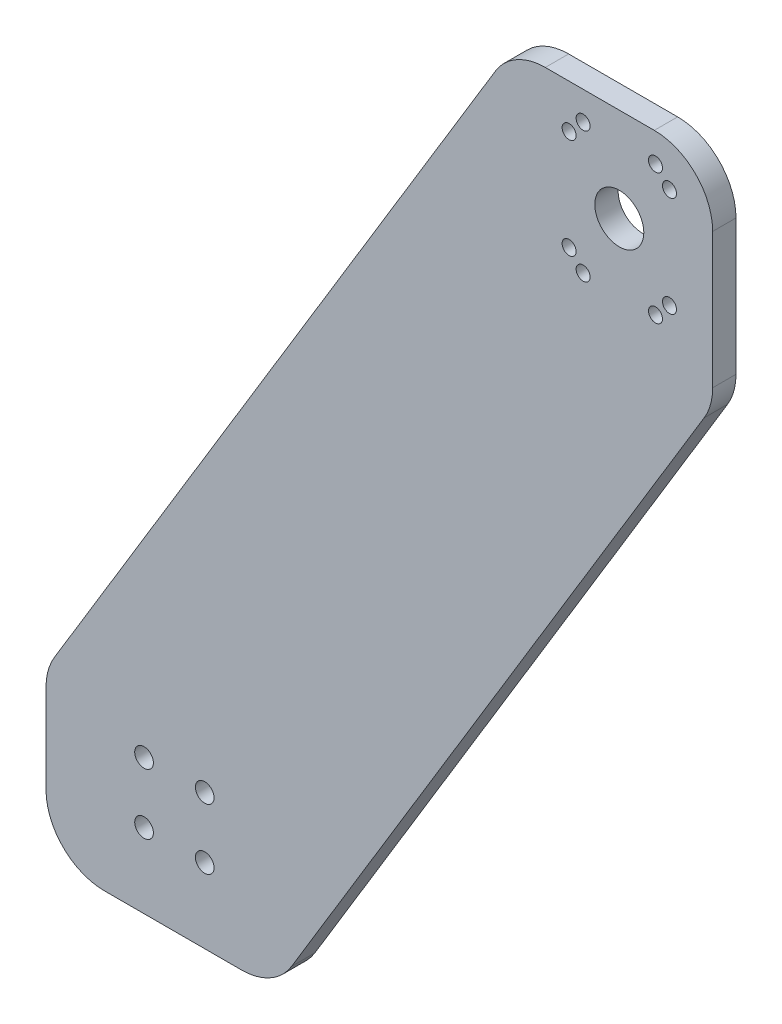
from build123d import *

# Parameters (mm, degrees)
SCHIZZO1_R                   = 4
SCHIZZO1_R_2                 = 10.5
SCHIZZO1_R_3                 = 3
ESTRUSIONE_ESTRUSIONE2_DEPTH = 10
SCHIZZO2_R                   = 2
TAGLIO_ESTRUSIONE1_DEPTH     = 15


with BuildPart() as part:
    # Schizzo1 → Estrusione-Estrusione2 (new body)
    with BuildSketch(Plane.XY):
        with BuildLine():
            Line((25, 0), (83.810825302, 0))
            ThreePointArc((83.810825302, 0), (96.083419143, 3.219654722), (105.194931806, 12.049324766))
            Line((105.194931806, 12.049324766), (282.024381214, 304.029450185))
            ThreePointArc((282.024381214, 304.029450185), (284.71933888, 310.257129904), (285.64027471, 316.980125419))
            Line((285.64027471, 316.980125419), (285.64027471, 375))
            ThreePointArc((285.64027471, 375), (278.31794424, 392.67766953), (260.64027471, 400))
            Line((260.64027471, 400), (213.941879948, 400))
            ThreePointArc((213.941879948, 400), (201.669286107, 396.780345278), (192.557773444, 387.950675234))
            Line((192.557773444, 387.950675234), (3.615893496, 75.970549815))
            ThreePointArc((3.615893496, 75.970549815), (0.92093583, 69.742870096), (0, 63.019874581))
            Line((0, 63.019874581), (0, 25))
            ThreePointArc((0, 25), (7.32233047, 7.32233047), (25, 0))
        make_face()
        with Locations((42.005015941, 58)):
            Circle(SCHIZZO1_R, mode=Mode.SUBTRACT)
        with Locations((68.005015941, 58)):
            Circle(SCHIZZO1_R, mode=Mode.SUBTRACT)
        with Locations((68.005015941, 32)):
            Circle(SCHIZZO1_R, mode=Mode.SUBTRACT)
        with Locations((42.005015941, 32)):
            Circle(SCHIZZO1_R, mode=Mode.SUBTRACT)
        with Locations((245.64027471, 359.776226195)):
            Circle(SCHIZZO1_R_2, mode=Mode.SUBTRACT)
        with Locations((230.14027471, 387.776226195)):
            Circle(SCHIZZO1_R_3, mode=Mode.SUBTRACT)
        with Locations((261.14027471, 387.776226195)):
            Circle(SCHIZZO1_R_3, mode=Mode.SUBTRACT)
        with Locations((267.143391926, 381.279343411)):
            Circle(SCHIZZO1_R_3, mode=Mode.SUBTRACT)
        with Locations((267.143391926, 338.273108979)):
            Circle(SCHIZZO1_R_3, mode=Mode.SUBTRACT)
        with Locations((261.14027471, 331.776226195)):
            Circle(SCHIZZO1_R_3, mode=Mode.SUBTRACT)
        with Locations((230.14027471, 331.776226195)):
            Circle(SCHIZZO1_R_3, mode=Mode.SUBTRACT)
        with Locations((224.137157494, 338.273108979)):
            Circle(SCHIZZO1_R_3, mode=Mode.SUBTRACT)
        with Locations((224.137157494, 381.279343411)):
            Circle(SCHIZZO1_R_3, mode=Mode.SUBTRACT)
    extrude(amount=-ESTRUSIONE_ESTRUSIONE2_DEPTH)

    # Schizzo2 → Taglio-Estrusione1 (cut)
    with BuildSketch(Plane.XZ):
        with Locations((54.405412651, -5)):
            Circle(SCHIZZO2_R)
        with Locations((81.905412651, -5)):
            Circle(SCHIZZO2_R)
        with Locations((26.905412651, -5)):
            Circle(SCHIZZO2_R)
    extrude(amount=-TAGLIO_ESTRUSIONE1_DEPTH, mode=Mode.SUBTRACT)


solid = part.part
